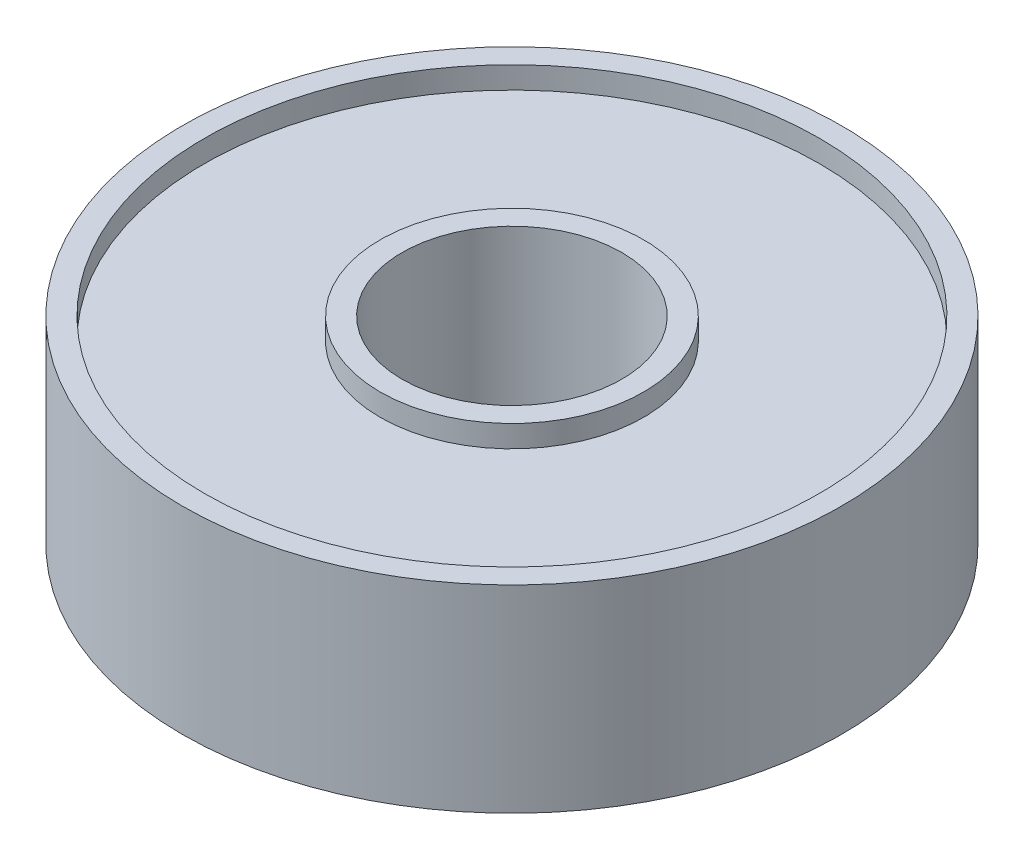
from build123d import *

# Parameters (mm, degrees)
SKETCH1_R            = 15
MAIN_EXTRUSION_DEPTH = 9
SKETCH2_R            = 5
ID_BORE_DEPTH        = 20
SKETCH3_R            = 14
SKETCH3_R_2          = 6
FACE_RECESS_DEPTH    = 1
CUT_EXTRUDE1_START   = -1
SKETCH4_R            = 14
SKETCH4_R_2          = 6
CUT_EXTRUDE1_DEPTH   = 1


with BuildPart() as part:
    # Sketch1 → main extrusion (new body)
    with BuildSketch(Plane(origin=(0, 0, 0), x_dir=(1, 0, 0), z_dir=(0, 1, 0))):
        Circle(SKETCH1_R)
    extrude(amount=MAIN_EXTRUSION_DEPTH)

    # Sketch2 → ID bore (cut)
    with BuildSketch(Plane(origin=(0, 9, 0), x_dir=(1, 0, 0), z_dir=(0, 1, 0))):
        Circle(SKETCH2_R)
    extrude(amount=-ID_BORE_DEPTH, mode=Mode.SUBTRACT)

    # Sketch3 → face recess (cut)
    with BuildSketch(Plane(origin=(0, 9, 0), x_dir=(1, 0, 0), z_dir=(0, 1, 0))):
        Circle(SKETCH3_R)
        Circle(SKETCH3_R_2, mode=Mode.SUBTRACT)
    extrude(amount=-FACE_RECESS_DEPTH, mode=Mode.SUBTRACT)

    # Sketch4 → Cut-Extrude1 (cut)
    with BuildSketch(Plane.XZ.offset(CUT_EXTRUDE1_START)):
        Circle(SKETCH4_R)
        Circle(SKETCH4_R_2, mode=Mode.SUBTRACT)
    extrude(amount=CUT_EXTRUDE1_DEPTH, mode=Mode.SUBTRACT)


solid = part.part
